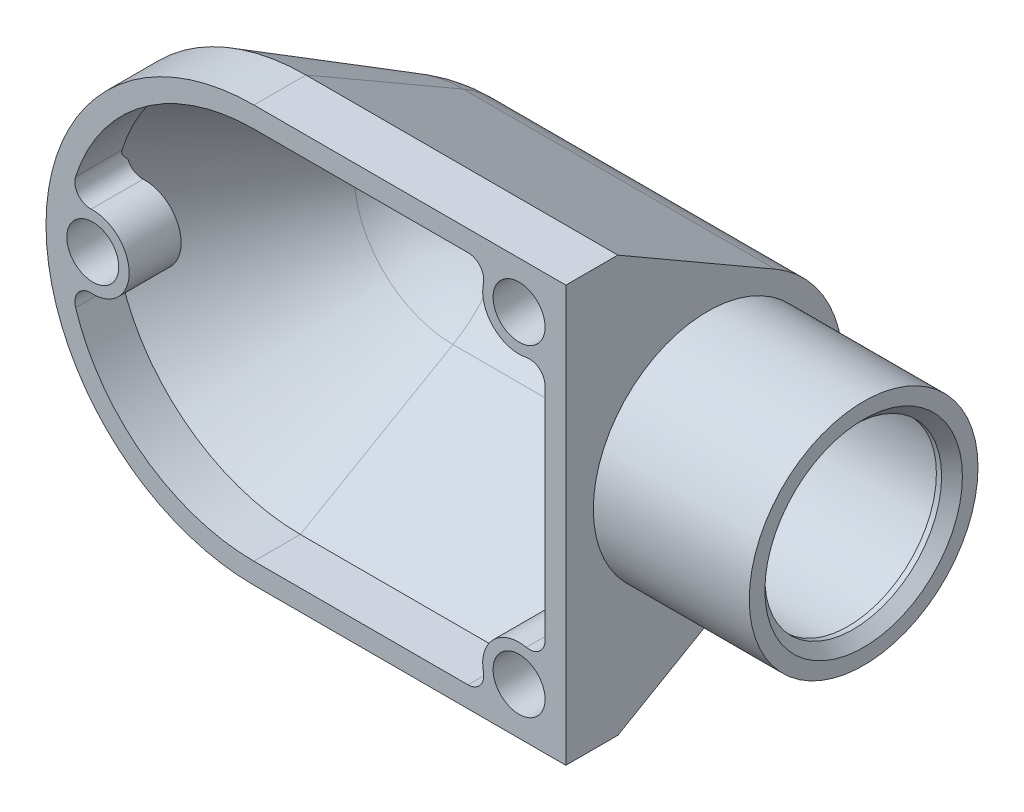
from build123d import *
from build123d.topology import SkipClean

# Parameters (mm, degrees)
EXTRUDE_3_DEPTH     = 5
EXTRUDE_4_DEPTH     = 30
REVOLVE_2_ANGLE     = 180
SKETCH_7_R          = 11
CUT_EXTRUDE_1_DEPTH = 10
SHELL_START         = -15.0000001
SHELL_1_DEPTH       = 28.0000001
SKETCH_8_R          = 3.5
SKETCH_8_R_2        = 2.5
EXTRUDE_5_DEPTH     = 5
FILLET_2_R          = 1.5
SKETCH_9_R          = 11
SKETCH_9_R_2        = 9.5
EXTRUDE_6_DEPTH     = 15
SKETCH_10_R         = 9.5
SKETCH_10_R_2       = 8.5
EXTRUDE_7_DEPTH     = 1.5
CHAMFER_1_SIZE      = 1


with BuildPart() as part:
    # 草图4 → 凸台-拉伸3 (new body)
    with BuildSketch(Plane.XY):
        with BuildLine():
            Line((15, 20), (-15, 20))
            ThreePointArc((-15, 20), (-35, 0), (-15, -20))
            Line((-15, -20), (15, -20))
            Line((15, -20), (15, 20))
        make_face()
    extrude(amount=EXTRUDE_3_DEPTH)

    # 草图5 → 凸台-拉伸4 (add)
    with BuildSketch(Plane(origin=(15, 0, 0), x_dir=(0, 0, -1), z_dir=(1, 0, 0))):
        with BuildLine():
            Line((0, 20), (15.141016151, 11.258330249))
            ThreePointArc((15.141016151, 11.258330249), (21.641016151, 0), (15.141016151, -11.258330249))
            Line((15.141016151, -11.258330249), (0, -20))
            Line((0, -20), (0, 20))
        make_face()
    extrude(amount=-EXTRUDE_4_DEPTH)

    # 草图6 → 旋转2 (revolve)
    with BuildSketch(Plane.ZY.offset(15)):
        with BuildLine():
            Line((-21.641016151, 0), (0, 0))
            Line((0, 0), (0, 20))
            Line((0, 20), (-15.141016151, 11.258330249))
            ThreePointArc((-15.141016151, 11.258330249), (-19.899346401, 6.5), (-21.641016151, 0))
        make_face()
    revolve(axis=Axis((-15, 0, 0), (0, 0, 1)), revolution_arc=REVOLVE_2_ANGLE)

    # 草图7 → 切除-拉伸1 (cut)
    with BuildSketch(Plane(origin=(15, 0, 0), x_dir=(0, 0, -1), z_dir=(1, 0, 0))):
        with Locations((8.641016151, 0)):
            Circle(SKETCH_7_R)
    extrude(amount=-CUT_EXTRUDE_1_DEPTH, mode=Mode.SUBTRACT)

    # 抽壳1: read off the stored shape, not the designer's step
    # 抽壳1 outline → 抽壳1 (cut)
    with SkipClean():  # the faces are left unmerged after this step: merging them gives an invalid solid
        with BuildSketch(Plane.YZ.offset(SHELL_START)):
            with BuildLine():
                ThreePointArc((-9.526279442, -14.141016151), (0, -19.641016151), (9.526279442, -14.141016151))
                Line((9.526279442, -14.141016151), (18, 0.535898385))
                Line((18, 0.535898385), (18, 5))
                Line((18, 5), (-18, 5))
                Line((-18, 5), (-18, 0.535898385))
                Line((-18, 0.535898385), (-9.526279442, -14.141016151))
            make_face()
        extrude(amount=SHELL_1_DEPTH, mode=Mode.SUBTRACT)
    add(part.part.scale(1), mode=Mode.REPLACE)  # the faces are merged on a copy

    # Shell 1 2 outline → Shell 1 2 (revolve, cut)
    with BuildSketch(Plane(origin=(-15, 0, 0), x_dir=(1, 0, 0), z_dir=(0, -1, 0))):
        with BuildLine():
            Line((18, 0.535898385), (18, 5))
            Line((18, 5), (0, 5))
            Line((0, 5), (0, -19.641016151))
            ThreePointArc((0, -19.641016151), (5.5, -18.167295593), (9.526279442, -14.141016151))
            Line((9.526279442, -14.141016151), (18, 0.535898385))
        make_face()
    revolve(axis=Axis((-15, 0, 0), (0, 0, 1)), mode=Mode.SUBTRACT)

    # 草图8 → 凸台-拉伸5 (add)
    # profile 1 of 3: a face of its own
    with BuildSketch(Plane.XY.offset(5)):
        with Locations((-30.5, 0)):
            Circle(SKETCH_8_R)
        with Locations((-30.5, 0)):
            Circle(SKETCH_8_R_2, mode=Mode.SUBTRACT)
    # profile 2 of 3: a face of its own
    with BuildSketch(Plane.XY.offset(5)):
        with Locations((10.5, 15.5)):
            Circle(SKETCH_8_R)
        with Locations((10.5, 15.5)):
            Circle(SKETCH_8_R_2, mode=Mode.SUBTRACT)
    # profile 3 of 3: a face of its own
    with BuildSketch(Plane.XY.offset(5)):
        with Locations((10.5, -15.5)):
            Circle(SKETCH_8_R)
        with Locations((10.5, -15.5)):
            Circle(SKETCH_8_R_2, mode=Mode.SUBTRACT)
    extrude(amount=-EXTRUDE_5_DEPTH)

    # 圆角2
    # the kernel refuses this fillet: 1.5 mm, written as the material it adds along each edge
    with BuildSketch(Plane(origin=(13, -13.050510257, 0), x_dir=(0, 1, 0), z_dir=(0, 0, 1))) as fillet_2_piece_1:
        with BuildLine():
            CenterArc((2.449489743, 1.5), FILLET_2_R, 168.463040967, 101.536959033)
            ThreePointArc((0.979795897, 1.8), (0.624595487, 0.826679947), (0, 0))
            Line((0, 0), (2.449489743, 0))
        make_face()
    extrude(amount=5)
    with BuildSketch(Plane(origin=(8.050510257, -18, -5.587825972), x_dir=(-1, 0, 0), z_dir=(0, 0, 1))) as fillet_2_piece_2_section:
        with BuildLine():
            CenterArc((2.449489743, -1.5), FILLET_2_R, 90, 101.536959033)
            ThreePointArc((0.979795897, -1.8), (0.624595487, -0.826679947), (0, 0))
            Line((0, 0), (2.449489743, 0))
        make_face()
    fillet_2_piece_2 = extrude(amount=10.587825972, mode=Mode.PRIVATE)
    fillet_2_piece_2 = split(fillet_2_piece_2, bisect_by=Plane(origin=(8.050510257, -18, 0), z_dir=(0, 0, 1)), keep=Keep.TOP, mode=Mode.PRIVATE)
    add(fillet_2_piece_2)
    with BuildSketch(Plane(origin=(8.050510257, 18, -5.587825972), x_dir=(-1, 0, 0), z_dir=(0, 0, 1))) as fillet_2_piece_3_section:
        with BuildLine():
            CenterArc((2.449489743, 1.5), FILLET_2_R, 168.463040967, 101.536959033)
            ThreePointArc((0.979795897, 1.8), (0.624595487, 0.826679947), (0, 0))
            Line((0, 0), (2.449489743, 0))
        make_face()
    fillet_2_piece_3 = extrude(amount=10.587825972, mode=Mode.PRIVATE)
    fillet_2_piece_3 = split(fillet_2_piece_3, bisect_by=Plane(origin=(8.050510257, 18, 0), z_dir=(0, 0, 1)), keep=Keep.TOP, mode=Mode.PRIVATE)
    add(fillet_2_piece_3)
    with BuildSketch(Plane(origin=(13, 13.050510257, 0), x_dir=(0, -1, 0), z_dir=(0, 0, 1))) as fillet_2_piece_4:
        with BuildLine():
            CenterArc((2.449489743, -1.5), FILLET_2_R, 90, 101.536959033)
            ThreePointArc((0.979795897, -1.8), (0.624595487, -0.826679947), (0, 0))
            Line((0, 0), (2.449489743, 0))
        make_face()
    extrude(amount=5)
    with BuildSketch(Plane(origin=(-32.806451613, -2.632542679, -6.690855654), x_dir=(0.22521397209049301, -0.974309328075649, 0), z_dir=(0, 0, 1))) as fillet_2_piece_5_section:
        with BuildLine():
            CenterArc((2.770255715, 1.495156442), FILLET_2_R, 164.396107483, 110.209545374)
            ThreePointArc((1.325539273, 1.898634324), (0.824332497, 0.836521394), (0, 0))
            ThreePointArc((0, 0), (1.445350808, -0.0581227), (2.890701616, 0))
        make_face()
    fillet_2_piece_5 = extrude(amount=11.690855654, mode=Mode.PRIVATE)
    fillet_2_piece_5 = split(fillet_2_piece_5, bisect_by=Plane(origin=(-32.806451613, -2.632542679, 0), z_dir=(0, 0, 1)), keep=Keep.TOP, mode=Mode.PRIVATE)
    add(fillet_2_piece_5)
    with BuildSketch(Plane(origin=(-32.806451613, 2.632542679, -6.690855654), x_dir=(0.2252139720904933, 0.974309328075649, 0), z_dir=(0, 0, 1))) as fillet_2_piece_6_section:
        with BuildLine():
            CenterArc((2.770255715, -1.495156442), FILLET_2_R, 85.394347143, 110.209545374)
            ThreePointArc((1.325539273, -1.898634324), (0.824332497, -0.836521394), (0, 0))
            ThreePointArc((0, 0), (1.445350808, 0.0581227), (2.890701616, 0))
        make_face()
    fillet_2_piece_6 = extrude(amount=11.690855654, mode=Mode.PRIVATE)
    fillet_2_piece_6 = split(fillet_2_piece_6, bisect_by=Plane(origin=(-32.806451613, 2.632542679, 0), z_dir=(0, 0, 1)), keep=Keep.TOP, mode=Mode.PRIVATE)
    add(fillet_2_piece_6)


with BuildPart() as body_2:
    # 草图9 → 凸台-拉伸6 (new body)
    with BuildSketch(Plane(origin=(15, 0, 0), x_dir=(0, 0, -1), z_dir=(1, 0, 0))):
        with Locations((8.641016151, 0)):
            Circle(SKETCH_9_R)
        with Locations((8.641016151, 0)):
            Circle(SKETCH_9_R_2, mode=Mode.SUBTRACT)
    extrude(amount=EXTRUDE_6_DEPTH)

    # 草图10 → 凸台-拉伸7 (add)
    with BuildSketch(Plane(origin=(30, 0, 0), x_dir=(0, 0, -1), z_dir=(1, 0, 0))):
        with Locations((8.641016151, 0)):
            Circle(SKETCH_10_R)
        with Locations((8.641016151, 0)):
            Circle(SKETCH_10_R_2, mode=Mode.SUBTRACT)
    extrude(amount=-EXTRUDE_7_DEPTH)

    # 倒角1
    chamfer_1_edges = [body_2.edges().sort_by_distance(p)[0] for p in [
        (30, 0, -0.141016151),
    ]]
    chamfer(chamfer_1_edges, length=CHAMFER_1_SIZE)


solid = Compound([part.part, body_2.part])
